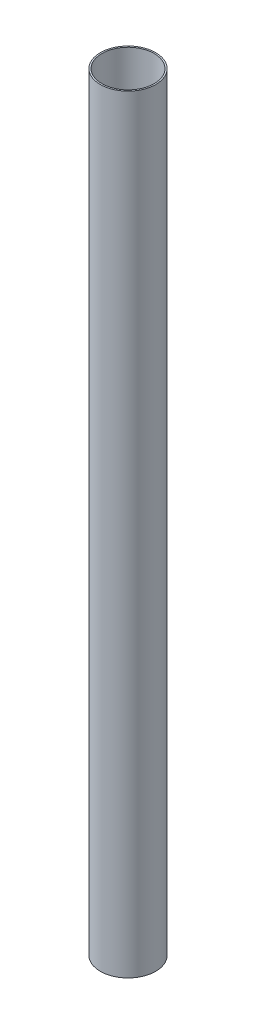
from build123d import *

# Parameters (mm, degrees)
SKETCH1_W = 1.4732
SKETCH1_H = 749.3


with BuildPart() as part:
    # Sketch1 → Revolve1 (revolve)
    with BuildSketch(Plane.XY):
        with Locations((26.2509, -322.439188343)):
            Rectangle(SKETCH1_W, SKETCH1_H)
    revolve(axis=Axis((0, 0, 0), (0, 1, 0)))


solid = part.part
